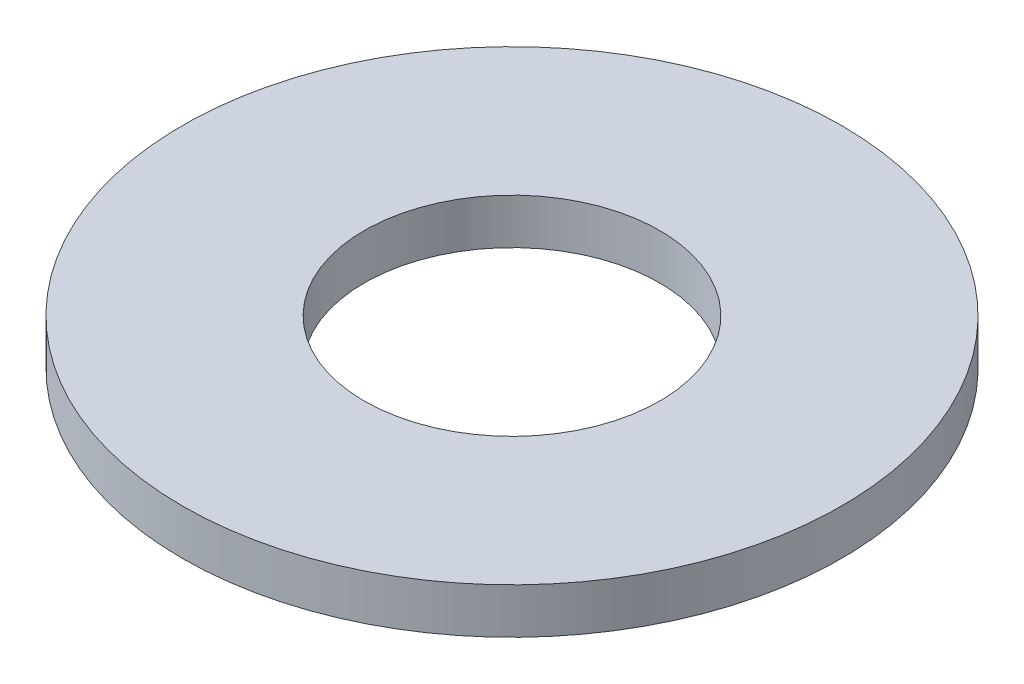
from build123d import *

# Parameters (mm, degrees)
SKETCH1_R           = 72.5
BOSS_EXTRUDE1_DEPTH = 10
SKETCH2_R           = 32.5
CUT_EXTRUDE1_DEPTH  = 104.01698889


with BuildPart() as part:
    # Sketch1 → Boss-Extrude1 (new body)
    with BuildSketch(Plane(origin=(0, 0, 0), x_dir=(1, 0, 0), z_dir=(0, 1, 0))):
        Circle(SKETCH1_R)
    extrude(amount=BOSS_EXTRUDE1_DEPTH)

    # Sketch2 → Cut-Extrude1 (cut, through all)
    with BuildSketch(Plane(origin=(0, 0, 0), x_dir=(1, 0, 0), z_dir=(0, 1, 0))):
        Circle(SKETCH2_R)
    extrude(amount=CUT_EXTRUDE1_DEPTH, mode=Mode.SUBTRACT)


solid = part.part
